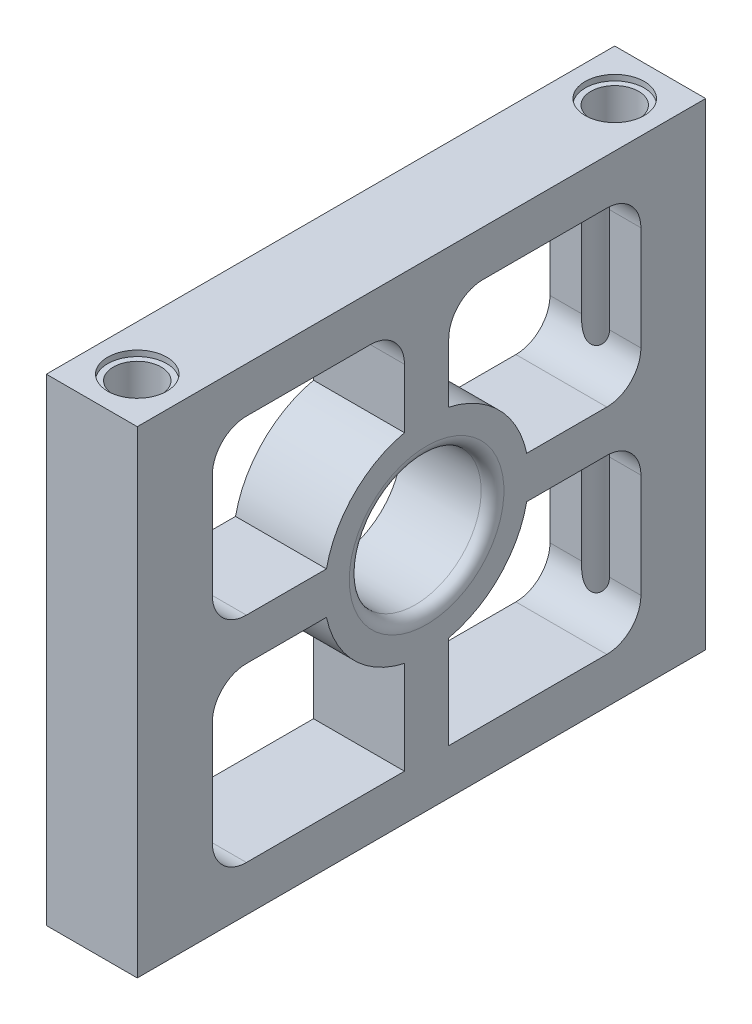
from build123d import *

# Parameters (mm, degrees)
SKETCH1_W           = 25
SKETCH1_H           = 50
SKETCH1_R           = 3.4
BOSS_EXTRUDE1_DEPTH = 3
SKETCH2_W           = 50
SKETCH2_H           = 3
BOSS_EXTRUDE2_DEPTH = 8
SKETCH3_W           = 8
SKETCH3_H           = 50
BOSS_EXTRUDE3_DEPTH = 42
SKETCH4_R           = 2.65
CUT_EXTRUDE1_DEPTH  = 0.5
SKETCH5_R           = 5.802370205
CUT_EXTRUDE2_DEPTH  = 9
FILLET2_R           = 1
SKETCH6_R           = 12.6
BOSS_EXTRUDE4_DEPTH = 2
FILLET4_R           = 1
SKETCH8_R           = 1.589780168
SKETCH8_R_2         = 1.777428262
CUT_EXTRUDE3_DEPTH  = 10
SKETCH9_W           = 49.021678163
SKETCH9_H           = 20.976854622
CUT_EXTRUDE4_DEPTH  = 68.79439129
SKETCH11_R          = 2.1
CUT_EXTRUDE5_DEPTH  = 59.480168703
SKETCH14_R          = 2.6
CUT_EXTRUDE6_DEPTH  = 0.5
CUT_EXTRUDE7_DEPTH  = 10


with BuildPart() as part:
    # Sketch1 → Boss-Extrude1 (new body)
    with BuildSketch(Plane(origin=(0, 0, 0), x_dir=(1, 0, 0), z_dir=(0, 1, 0))):
        with Locations((2.276951673, 11.384758364)):
            Rectangle(SKETCH1_W, SKETCH1_H)
        with Locations(Location((1.276951673, 11.384758364, 0), (0, 0, 270))):
            Circle(SKETCH1_R, mode=Mode.SUBTRACT)
    extrude(amount=BOSS_EXTRUDE1_DEPTH)

    # Sketch2 → Boss-Extrude2 (add)
    with BuildSketch(Plane.ZY.offset(10.223048327)):
        with Locations((-11.384758364, 1.5)):
            Rectangle(SKETCH2_W, SKETCH2_H)
    extrude(amount=BOSS_EXTRUDE2_DEPTH)

    # Sketch3 → Boss-Extrude3 (add)
    with BuildSketch(Plane.XZ):
        with Locations((-14.223048327, -11.384758364)):
            Rectangle(SKETCH3_W, SKETCH3_H)
    extrude(amount=BOSS_EXTRUDE3_DEPTH)

    # Sketch4 → Cut-Extrude1 (cut)
    with BuildSketch(Plane(origin=(0, 3, 0), x_dir=(1, 0, 0), z_dir=(0, 1, 0))):
        with Locations(Location((-14.223048327, 32.384758364, 0), (0, 0, 270))):
            Circle(SKETCH4_R)
        with Locations(Location((-14.223048327, -9.615241636, 0), (0, 0, 270))):
            Circle(SKETCH4_R)
    cut_extrude1 = extrude(amount=-CUT_EXTRUDE1_DEPTH, mode=Mode.SUBTRACT)

    # Mirror1: Cut-Extrude1 across plane
    add(cut_extrude1.mirror(Plane.ZX.offset(-19.5)), mode=Mode.SUBTRACT)

    # Sketch5 → Cut-Extrude2 (cut)
    with BuildSketch(Plane.ZY.offset(18.223048327)):
        with Locations((-11.836279124, -21)):
            Circle(SKETCH5_R)
    extrude(amount=-CUT_EXTRUDE2_DEPTH, mode=Mode.SUBTRACT)

    # Fillet2
    fillet2_edges = [part.edges().sort_by_distance(p)[0] for p in [
        (-10.223048327, -21, -17.638649329),
    ]]
    fillet(fillet2_edges, radius=FILLET2_R)

    # Mirror2: Cut-Extrude1 across plane
    add(cut_extrude1.mirror(Plane.ZY.offset(1.723048327)), mode=Mode.SUBTRACT)

    # Sketch6 → Boss-Extrude4 (add)
    with BuildSketch(Plane(origin=(0, 3, 0), x_dir=(1, 0, 0), z_dir=(0, 1, 0))):
        with BuildLine():
            Line((14.776951673, 5.825082115), (14.776951673, 16.944434614))
            ThreePointArc((14.776951673, 16.944434614), (-13.323048327, 11.384758364), (14.776951673, 5.825082115))
        make_face()
        with Locations(Location((1.276951673, 11.384758364, 0), (0, 0, 270))):
            Circle(SKETCH6_R, mode=Mode.SUBTRACT)
    extrude(amount=BOSS_EXTRUDE4_DEPTH)

    # Fillet4
    # the kernel refuses this fillet: 1 mm, written as the material it takes off along each edge
    with BuildSketch(Plane(origin=(14.776951673, 5, -3.325082115), x_dir=(0, -1, 0), z_dir=(0, 0, -1))) as fillet4_piece_1:
        with BuildLine():
            CenterArc((FILLET4_R, FILLET4_R), FILLET4_R, 180, 90)
            Line((0, FILLET4_R), (0, 0))
            Line((0, 0), (FILLET4_R, 0))
        make_face()
    extrude(amount=16.119352499, mode=Mode.SUBTRACT)

    # Sketch8 → Cut-Extrude3 (cut)
    with BuildSketch(Plane(origin=(0, 3, 0), x_dir=(1, 0, 0), z_dir=(0, 1, 0))):
        with Locations(Location((1.276951673, 19.884758364, 0), (0, 0, 270))):
            Circle(SKETCH8_R)
        with Locations(Location((1.276951673, 2.884758364, 0), (0, 0, 270))):
            Circle(SKETCH8_R_2)
    extrude(amount=-CUT_EXTRUDE3_DEPTH, mode=Mode.SUBTRACT)

    # Sketch9 → Cut-Extrude4 (cut, through all)
    with BuildSketch(Plane.XY.offset(13.615241636)):
        with Locations((-9.733887409, 10.488427311)):
            Rectangle(SKETCH9_W, SKETCH9_H)
    extrude(amount=-CUT_EXTRUDE4_DEPTH, mode=Mode.SUBTRACT)

    # Sketch11 → Cut-Extrude5 (cut, through all)
    with BuildSketch(Plane(origin=(0, 0, 0), x_dir=(1, 0, 0), z_dir=(0, 1, 0))):
        with Locations(Location((-14.223048327, 32.384758364, 0), (0, 0, 270))):
            Circle(SKETCH11_R)
    cut_extrude5 = extrude(amount=-CUT_EXTRUDE5_DEPTH, mode=Mode.SUBTRACT)

    # Mirror3: Cut-Extrude5 across plane
    add(cut_extrude5.mirror(Plane.XY.offset(-11.384758364)), mode=Mode.SUBTRACT)

    # Sketch14 → Cut-Extrude6 (cut)
    with BuildSketch(Plane(origin=(0, 0, 0), x_dir=(1, 0, 0), z_dir=(0, 1, 0))):
        with Locations(Location((-14.223048327, -9.615241636, 0), (0, 0, 270))):
            Circle(SKETCH14_R)
    cut_extrude6 = extrude(amount=-CUT_EXTRUDE6_DEPTH, mode=Mode.SUBTRACT)

    # Mirror4: Cut-Extrude6 across plane
    add(cut_extrude6.mirror(Plane.XY.offset(-11.384758364)), mode=Mode.SUBTRACT)

    # Sketch15 → Cut-Extrude7 (cut)
    with BuildSketch(Plane(origin=(-10.223048327, 0, 0), x_dir=(0, 0, -1), z_dir=(1, 0, 0))):
        with BuildLine():
            ThreePointArc((-4.015241636, -4), (-6.136561979, -4.878679656), (-7.015241636, -7))
            Line((-7.015241636, -7), (-7.015241636, -16.15570602))
            ThreePointArc((-7.015241636, -16.15570602), (-6.136561979, -18.277026364), (-4.015241636, -19.15570602))
            Line((-4.015241636, -19.15570602), (3.027273521, -19.15570602))
            ThreePointArc((3.027273521, -19.15570602), (5.435051506, -14.673525074), (9.888641359, -12.213265275))
            Line((9.888641359, -12.213265275), (9.888641359, -7))
            ThreePointArc((9.888641359, -7), (9.009961702, -4.878679656), (6.888641359, -4))
            Line((6.888641359, -4), (-4.015241636, -4))
        make_face()
        with BuildLine():
            Line((13.783916889, -7), (13.783916889, -12.213265275))
            ThreePointArc((13.783916889, -12.213265275), (18.237506742, -14.673525074), (20.645284727, -19.15570602))
            Line((20.645284727, -19.15570602), (27.687799884, -19.15570602))
            ThreePointArc((27.687799884, -19.15570602), (29.809120227, -18.277026364), (30.687799884, -16.15570602))
            Line((30.687799884, -16.15570602), (30.687799884, -7))
            ThreePointArc((30.687799884, -7), (29.809120227, -4.878679656), (27.687799884, -4))
            Line((27.687799884, -4), (16.783916889, -4))
            ThreePointArc((16.783916889, -4), (14.662596546, -4.878679656), (13.783916889, -7))
        make_face()
        with BuildLine():
            ThreePointArc((20.645284727, -22.84429398), (18.237506742, -27.326474926), (13.783916889, -29.786734725))
            Line((13.783916889, -29.786734725), (13.783916889, -38))
            Line((13.783916889, -38), (27.687799884, -38))
            ThreePointArc((27.687799884, -38), (29.809120227, -37.121320344), (30.687799884, -35))
            Line((30.687799884, -35), (30.687799884, -25.84429398))
            ThreePointArc((30.687799884, -25.84429398), (29.809120227, -23.722973636), (27.687799884, -22.84429398))
            Line((27.687799884, -22.84429398), (20.645284727, -22.84429398))
        make_face()
        with BuildLine():
            ThreePointArc((9.888641359, -29.786734725), (5.435051506, -27.326474926), (3.027273521, -22.84429398))
            Line((3.027273521, -22.84429398), (-4.015241636, -22.84429398))
            ThreePointArc((-4.015241636, -22.84429398), (-6.136561979, -23.722973636), (-7.015241636, -25.84429398))
            Line((-7.015241636, -25.84429398), (-7.015241636, -35))
            ThreePointArc((-7.015241636, -35), (-6.136561979, -37.121320344), (-4.015241636, -38))
            Line((-4.015241636, -38), (9.888641359, -38))
            Line((9.888641359, -38), (9.888641359, -29.786734725))
        make_face()
    extrude(amount=-CUT_EXTRUDE7_DEPTH, mode=Mode.SUBTRACT)


solid = part.part
